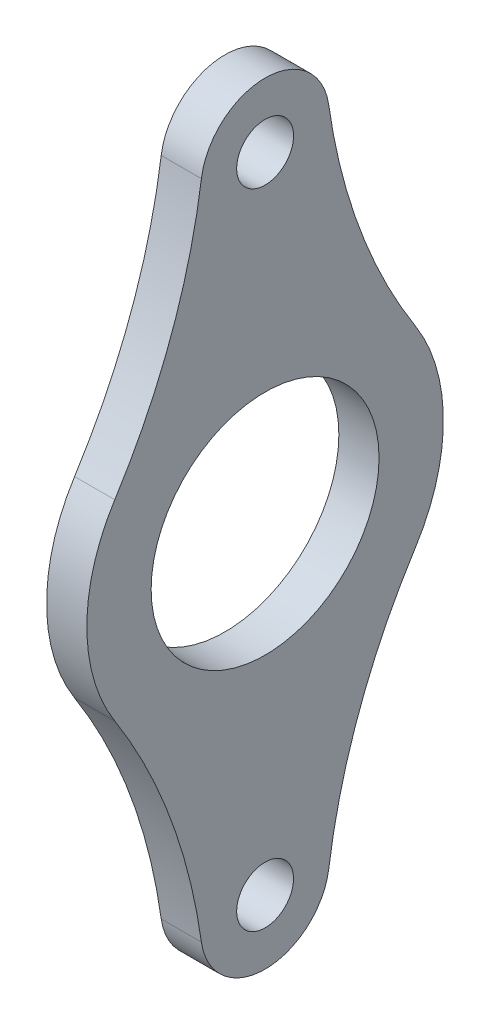
from build123d import *

# Parameters (mm, degrees)
SKETCH1_R           = 2.2479
SKETCH1_R_2         = 9.000000034
BOSS_EXTRUDE1_DEPTH = 3.175


with BuildPart() as part:
    # Sketch1 → Boss-Extrude1 (new body)
    with BuildSketch(Plane.ZY.offset(-47.188)):
        with BuildLine():
            ThreePointArc((-11.872772186, 7.568598389), (-14.080000034, 0), (-11.872772186, -7.568598389))
            ThreePointArc((-11.872772186, -7.568598389), (-7.456309271, -16.470429165), (-5.030561789, -26.106999353))
            ThreePointArc((-5.030561789, -26.106999353), (0, -30.48), (5.030561789, -26.106999353))
            ThreePointArc((5.030561789, -26.106999353), (7.456309271, -16.470429165), (11.872772186, -7.568598389))
            ThreePointArc((11.872772186, -7.568598389), (14.080000034, 0), (11.872772186, 7.568598389))
            ThreePointArc((11.872772186, 7.568598389), (7.456309271, 16.470429165), (5.030561789, 26.106999353))
            ThreePointArc((5.030561789, 26.106999353), (0, 30.48), (-5.030561789, 26.106999353))
            ThreePointArc((-5.030561789, 26.106999353), (-7.456309271, 16.470429165), (-11.872772186, 7.568598389))
        make_face()
        with Locations((0, -25.4)):
            Circle(SKETCH1_R, mode=Mode.SUBTRACT)
        with Locations((0, 25.4)):
            Circle(SKETCH1_R, mode=Mode.SUBTRACT)
        Circle(SKETCH1_R_2, mode=Mode.SUBTRACT)
    extrude(amount=BOSS_EXTRUDE1_DEPTH)


solid = part.part
